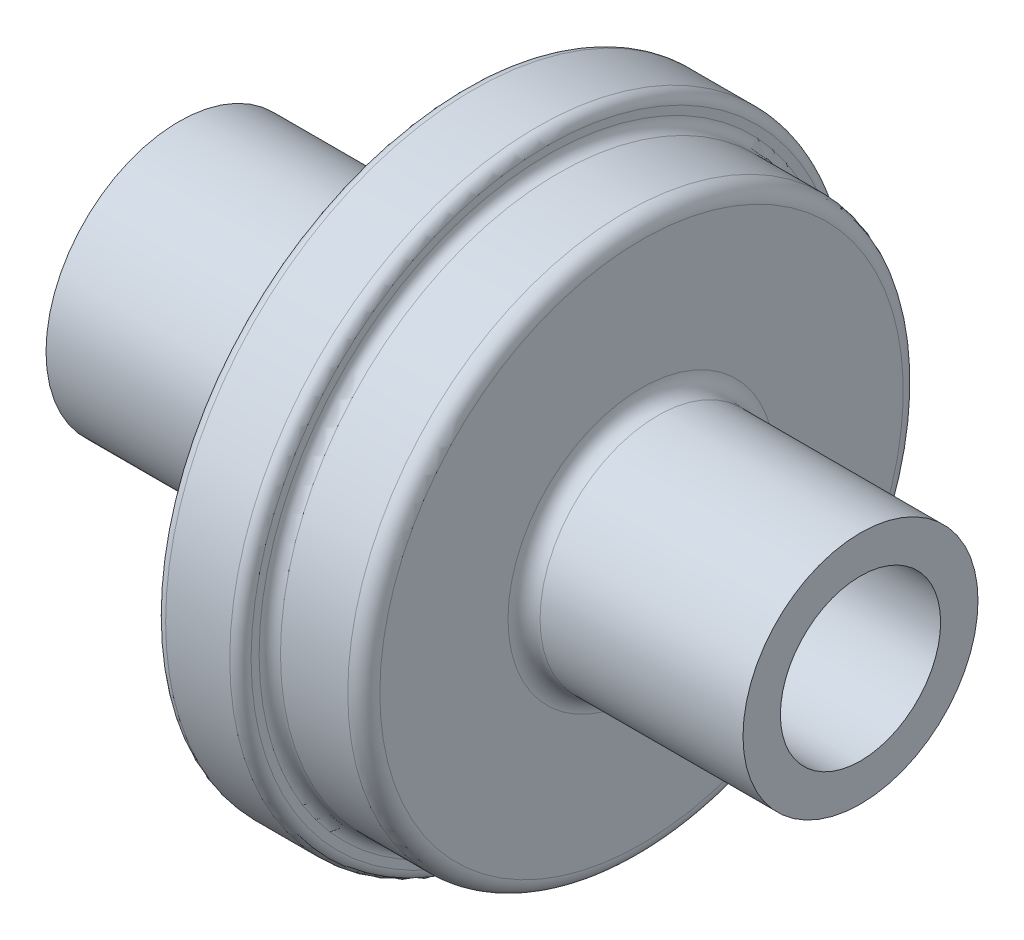
from build123d import *

# Parameters (mm, degrees)
CROQUIS1_R                 = 11
SALIENTE_EXTRUIR1_DEPTH    = 20.5
CROQUIS2_R                 = 26
SALIENTE_EXTRUIR2_DEPTH    = 8.8
CROQUIS3_R                 = 28.75
SALIENTE_EXTRUIR3_DEPTH    = 8
CROQUIS4_R                 = 12.45
SALIENTE_EXTRUIR4_DEPTH    = 26.5
REDONDEO1_R                = 1.5
REDONDEO2_R                = 1.5
REDONDEO3_R                = 1
REDONDEO4_R                = 1
CHAFL_N1_SIZE              = 4.5
CORTAR_EXTRUIR1_DEPTH      = 40
CORTAR_EXTRUIR1_DEPTH_BACK = 82.5
CROQUIS5_R                 = 7.5
CROQUIS8_R                 = 19.032957951
CORTAR_EXTRUIR3_DEPTH      = 14.8


# Read off the part's stored shape, not the designer's step: Vaciado3
with BuildPart() as part:
    # Croquis1 → Saliente-Extruir1 (new body)
    with BuildSketch(Plane(origin=(0, 0, 0), x_dir=(0, 0, -1), z_dir=(1, 0, 0))):
        Circle(CROQUIS1_R)
    extrude(amount=SALIENTE_EXTRUIR1_DEPTH)

    # Croquis2 → Saliente-Extruir2 (add)
    with BuildSketch(Plane.ZY):
        Circle(CROQUIS2_R)
    extrude(amount=SALIENTE_EXTRUIR2_DEPTH)

    # Croquis3 → Saliente-Extruir3 (add)
    with BuildSketch(Plane.ZY.offset(8.8)):
        Circle(CROQUIS3_R)
    extrude(amount=SALIENTE_EXTRUIR3_DEPTH)

    # Croquis4 → Saliente-Extruir4 (add)
    with BuildSketch(Plane.ZY.offset(16.8)):
        Circle(CROQUIS4_R)
    extrude(amount=SALIENTE_EXTRUIR4_DEPTH)

    # Redondeo1
    redondeo1_edges = [part.edges().sort_by_distance(p)[0] for p in [
        (0, 0, 11),
    ]]
    fillet(redondeo1_edges, radius=REDONDEO1_R)

    # Redondeo2
    redondeo2_edges = [part.edges().sort_by_distance(p)[0] for p in [
        (0, 0, -26),
    ]]
    fillet(redondeo2_edges, radius=REDONDEO2_R)

    # Redondeo3
    redondeo3_edges = [part.edges().sort_by_distance(p)[0] for p in [
        (-8.8, 0, -26),
    ]]
    fillet(redondeo3_edges, radius=REDONDEO3_R)

    # Redondeo4
    redondeo4_edges = [part.edges().sort_by_distance(p)[0] for p in [
        (-16.8, 0, -28.75),
        (-8.8, 0, -28.75),
    ]]
    fillet(redondeo4_edges, radius=REDONDEO4_R)

    # Chaflán1
    chafl_n1_edges = [part.edges().sort_by_distance(p)[0] for p in [
        (-16.8, 0, -12.45),
    ]]
    chamfer(chafl_n1_edges, length=CHAFL_N1_SIZE)

    # Croquis5 → Cortar-Extruir1 (cut, two sides: drawn at the far end of the back side and taken through both)
    with BuildSketch(Plane(origin=(20.5, 0, 0), x_dir=(0, 0, -1), z_dir=(1, 0, 0)).offset(-CORTAR_EXTRUIR1_DEPTH_BACK)):
        with Locations(Location((0, 0, 0), (0, 0, 180))):
            Circle(CROQUIS5_R)
    extrude(amount=CORTAR_EXTRUIR1_DEPTH + CORTAR_EXTRUIR1_DEPTH_BACK, mode=Mode.SUBTRACT)

    # Vaciado3 outline → Vaciado3 (revolve, cut)
    with BuildSketch(Plane.YX):
        with BuildLine():
            Line((10, 1.5), (10, 19.5))
            Line((10, 19.5), (8.5, 19.5))
            Line((8.5, 19.5), (8.5, -42.3))
            Line((8.5, -42.3), (11.45, -42.3))
            Line((11.45, -42.3), (11.45, -20.885786438))
            Line((11.45, -20.885786438), (16.535786438, -15.8))
            Line((16.535786438, -15.8), (27.75, -15.8))
            Line((27.75, -15.8), (27.75, -9.8))
            Line((27.75, -9.8), (27, -9.8))
            ThreePointArc((27, -9.8), (25.585786438, -9.214213562), (25, -7.8))
            Line((25, -7.8), (25, -1.5))
            ThreePointArc((25, -1.5), (24.853553391, -1.146446609), (24.5, -1))
            Line((24.5, -1), (12.5, -1))
            ThreePointArc((12.5, -1), (10.732233047, -0.267766953), (10, 1.5))
        make_face()
    revolve(axis=Axis((0, 0, 0), (1, 0, 0)), mode=Mode.SUBTRACT)

    # Croquis8 → Cortar-Extruir3 (cut)
    with BuildSketch(Plane(origin=(-15.8, 0, 0), x_dir=(0, 0, -1), z_dir=(1, 0, 0))):
        Circle(CROQUIS8_R)
    extrude(amount=CORTAR_EXTRUIR3_DEPTH, mode=Mode.SUBTRACT)


solid = part.part
